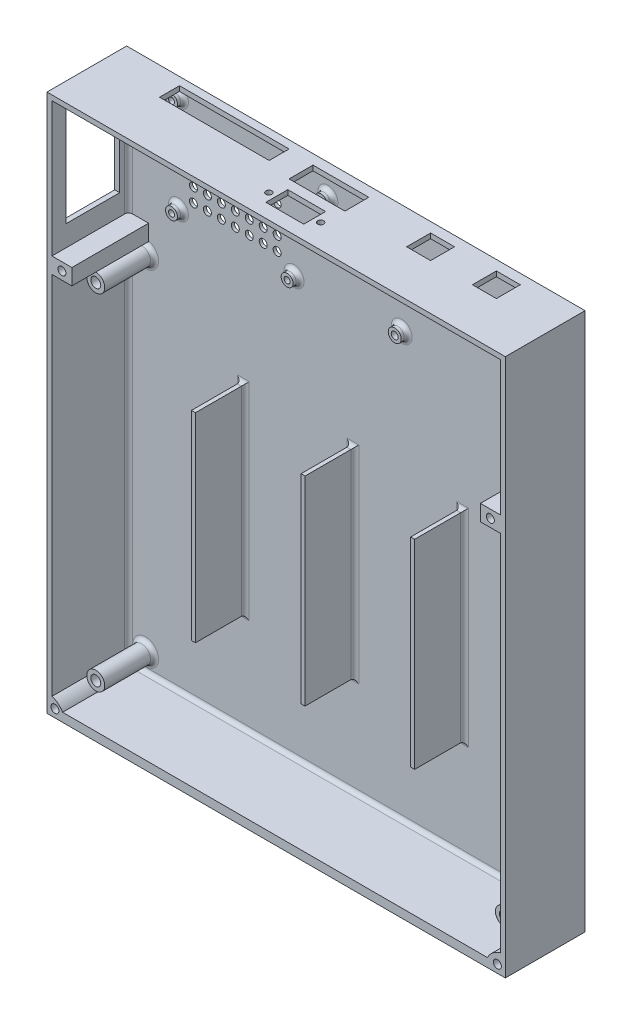
from build123d import *

# Parameters (mm, degrees)
ESQUISSE1_W              = 230
ESQUISSE1_H              = 270
BOSS_EXTRU_1_DEPTH       = 5
ESQUISSE2_R              = 2
ESQUISSE2_R_2            = 1.75
ESQUISSE2_R_3            = 1.5
ENL_V_MAT_EXTRU_1_DEPTH  = 5
COQUE3_T                 = -1.5
ESQUISSE3_R              = 4.5
ESQUISSE3_R_2            = 2.5
BOSS_EXTRU_3_DEPTH       = 25
ESQUISSE4_W              = 1
ESQUISSE4_H              = 267
BOSS_EXTRU_4_DEPTH       = 3.5
ESQUISSE5_W              = 225
ESQUISSE5_H              = 1
ESQUISSE5_H_2            = 2.9
BOSS_EXTRU_10_DEPTH      = 3.5
ESQUISSE7_W              = 2
ESQUISSE7_H              = 100
BOSS_EXTRU_11_DEPTH      = 25
ESQUISSE8_W              = 230
ESQUISSE8_H              = 270
ESQUISSE8_W_2            = 225
ESQUISSE8_H_2            = 263.1
BOSS_EXTRU_12_DEPTH      = 35
CONG_1_R                 = 2
ESQUISSE11_W             = 55
ESQUISSE11_H             = 10
ESQUISSE11_W_2           = 28
ESQUISSE11_H_2           = 12
ESQUISSE11_W_3           = 12
ENL_V_MAT_EXTRU_3_DEPTH  = 10
ESQUISSE13_W             = 27
ESQUISSE13_H             = 55
ENL_V_MAT_EXTRU_4_DEPTH  = 10
ESQUISSE14_R             = 2
ENL_V_MAT_EXTRU_5_DEPTH  = 10
BOSS_EXTRU_13_DEPTH      = 40
BOSS_EXTRU_14_START      = 13.5
BOSS_EXTRU_14_DEPTH      = 40
ENL_V_START              = 13.5
ESQUISSE17_R             = 2
ENL_V_MAT_EXTRU_6_DEPTH  = 40
ESQUISSE18_R             = 2
ENL_V_MAT_EXTRU_7_DEPTH  = 40
ESQUISSE21_R             = 1.5
ESQUISSE21_W             = 19
ESQUISSE21_H             = 11
ENL_V_MAT_EXTRU_8_DEPTH  = 2.5
ESQUISSE28_W             = 10
ESQUISSE28_H             = 8
BOSS_EXTRU_16_DEPTH      = 38.5
ESQUISSE29_R             = 2
ENL_V_MAT_EXTRU_10_DEPTH = 215.474512253
ESQUISSE30_W             = 10
ESQUISSE30_H             = 8
BOSS_EXTRU_17_DEPTH      = 38.5
ESQUISSE31_R             = 2
ENL_V_MAT_EXTRU_11_DEPTH = 215.474512253


with BuildPart() as part:
    # Esquisse1 → Boss.-Extru.1 (new body)
    with BuildSketch(Plane.XY):
        with Locations((0, -41.5625)):
            Rectangle(ESQUISSE1_W, ESQUISSE1_H)
    extrude(amount=BOSS_EXTRU_1_DEPTH)

    # Esquisse2 → Enlèv. mat.-Extru.1 (cut)
    with BuildSketch(Plane.XY.offset(5)):
        with Locations((-104, -163.5625)):
            Circle(ESQUISSE2_R)
        with Locations(Location((-104, 9.4375, 0), (0, 0, 180))):
            Circle(ESQUISSE2_R)
        with Locations((104.5, 82.9375)):
            Circle(ESQUISSE2_R_2)
        with Locations((24.5, 82.9375)):
            Circle(ESQUISSE2_R_2)
        with Locations(Location((24.5, 39.9375, 0), (0, 0, 180))):
            Circle(ESQUISSE2_R_2)
        with Locations(Location((104.5, 39.9375, 0), (0, 0, 180))):
            Circle(ESQUISSE2_R_2)
        with Locations((-87.5, 85.9375)):
            Circle(ESQUISSE2_R_3)
        with Locations(Location((-29.5, 85.9375, 0), (0, 0, 180))):
            Circle(ESQUISSE2_R_3)
        with Locations((8.5, 67.4375)):
            Circle(ESQUISSE2_R_3)
        with Locations(Location((-12.5, 67.4375, 0), (0, 0, 180))):
            Circle(ESQUISSE2_R_3)
        with Locations((-12.5, 79.9375)):
            Circle(ESQUISSE2_R_3)
        with Locations(Location((8.5, 79.9375, 0), (0, 0, 180))):
            Circle(ESQUISSE2_R_3)
        with Locations(Location((101, -163.5625, 0), (0, 0, 180))):
            Circle(ESQUISSE2_R)
        with Locations((101, 9.4375)):
            Circle(ESQUISSE2_R)
        with Locations(Location((-87.5, 36.9375, 0), (0, 0, 180))):
            Circle(ESQUISSE2_R_3)
        with Locations((-29.5, 36.9375)):
            Circle(ESQUISSE2_R_3)
    extrude(amount=-ENL_V_MAT_EXTRU_1_DEPTH, mode=Mode.SUBTRACT)

    # Coque3
    coque3_openings = [part.faces().sort_by_distance(p)[0] for p in [
        (-0.011238138, -41.697281592, 5),
    ]]
    offset(amount=COQUE3_T, openings=coque3_openings, kind=Kind.INTERSECTION)

    # Esquisse3 → Boss.-Extru.3 (add)
    # profile 1 of 4: a face of its own
    with BuildSketch(Plane.XY.offset(1.5)):
        with Locations(Location((-104, 9.4375, 0), (0, 0, 180))):
            Circle(ESQUISSE3_R)
        with Locations(Location((-104, 9.4375, 0), (0, 0, 180))):
            Circle(ESQUISSE3_R_2, mode=Mode.SUBTRACT)
    # profile 2 of 4: a face of its own
    with BuildSketch(Plane.XY.offset(1.5)):
        with Locations(Location((-104, -163.5625, 0), (0, 0, 180))):
            Circle(ESQUISSE3_R)
        with Locations(Location((-104, -163.5625, 0), (0, 0, 180))):
            Circle(ESQUISSE3_R_2, mode=Mode.SUBTRACT)
    # profile 3 of 4: a face of its own
    with BuildSketch(Plane.XY.offset(1.5)):
        with Locations(Location((101, -163.5625, 0), (0, 0, 180))):
            Circle(ESQUISSE3_R)
        with Locations(Location((101, -163.5625, 0), (0, 0, 180))):
            Circle(ESQUISSE3_R_2, mode=Mode.SUBTRACT)
    # profile 4 of 4: a face of its own
    with BuildSketch(Plane.XY.offset(1.5)):
        with Locations(Location((101, 9.4375, 0), (0, 0, 180))):
            Circle(ESQUISSE3_R)
        with Locations(Location((101, 9.4375, 0), (0, 0, 180))):
            Circle(ESQUISSE3_R_2, mode=Mode.SUBTRACT)
    extrude(amount=BOSS_EXTRU_3_DEPTH)

    # Esquisse4 → Boss.-Extru.4 (add)
    with BuildSketch(Plane.XY.offset(1.5)):
        with Locations((-113, -41.5625)):
            Rectangle(ESQUISSE4_W, ESQUISSE4_H)
        with Locations((113, -41.5625)):
            Rectangle(ESQUISSE4_W, ESQUISSE4_H)
    extrude(amount=BOSS_EXTRU_4_DEPTH)

    # Esquisse5 → Boss.-Extru.10 (add)
    with BuildSketch(Plane.XY.offset(1.5)):
        with Locations((0, 91.4375)):
            Rectangle(ESQUISSE5_W, ESQUISSE5_H)
        with Locations((0, -173.6125)):
            Rectangle(ESQUISSE5_W, ESQUISSE5_H_2)
    extrude(amount=BOSS_EXTRU_10_DEPTH)

    # Esquisse7 → Boss.-Extru.11 (add)
    with BuildSketch(Plane.XY.offset(1.5)):
        with Locations((0, -72.1625)):
            Rectangle(ESQUISSE7_W, ESQUISSE7_H)
        with Locations((-55, -72.1625)):
            Rectangle(ESQUISSE7_W, ESQUISSE7_H)
        with Locations((55, -72.1625)):
            Rectangle(ESQUISSE7_W, ESQUISSE7_H)
    extrude(amount=BOSS_EXTRU_11_DEPTH)

    # Esquisse8 → Boss.-Extru.12 (add)
    with BuildSketch(Plane.XY.offset(5)):
        with Locations((0, -41.5625)):
            Rectangle(ESQUISSE8_W, ESQUISSE8_H)
        with Locations((0, -40.6125)):
            Rectangle(ESQUISSE8_W_2, ESQUISSE8_H_2, mode=Mode.SUBTRACT)
    extrude(amount=BOSS_EXTRU_12_DEPTH)

    # Congé1
    # the kernel refuses this fillet: 2 mm, written as the material it adds along each edge
    with BuildSketch(Plane(origin=(-104, 9.4375, 1.5), x_dir=(-1, 0, 0), z_dir=(0, 1, 0))) as cong_1_piece_1:
        with BuildLine():
            CenterArc((4.5 + CONG_1_R, CONG_1_R), CONG_1_R, 180, 90)
            Line((4.5, CONG_1_R), (4.5 - CONG_1_R * 0.02, CONG_1_R))
            Line((4.5 - CONG_1_R * 0.02, CONG_1_R), (4.5 - CONG_1_R * 0.02, -CONG_1_R * 0.02))
            Line((4.5 - CONG_1_R * 0.02, -CONG_1_R * 0.02), (4.5 + CONG_1_R, -CONG_1_R * 0.02))
            Line((4.5 + CONG_1_R, -CONG_1_R * 0.02), (4.5 + CONG_1_R, 0))
        make_face()
    revolve(axis=Axis((-104, 9.4375, 1.5), (0, 0, 1)))
    with BuildSketch(Plane(origin=(101, -163.5625, 1.5), x_dir=(-1, 0, 0), z_dir=(0, 1, 0))) as cong_1_piece_2:
        with BuildLine():
            CenterArc((4.5 + CONG_1_R, CONG_1_R), CONG_1_R, 180, 90)
            Line((4.5, CONG_1_R), (4.5 - CONG_1_R * 0.02, CONG_1_R))
            Line((4.5 - CONG_1_R * 0.02, CONG_1_R), (4.5 - CONG_1_R * 0.02, -CONG_1_R * 0.02))
            Line((4.5 - CONG_1_R * 0.02, -CONG_1_R * 0.02), (4.5 + CONG_1_R, -CONG_1_R * 0.02))
            Line((4.5 + CONG_1_R, -CONG_1_R * 0.02), (4.5 + CONG_1_R, 0))
        make_face()
    revolve(axis=Axis((101, -163.5625, 1.5), (0, 0, 1)))
    with BuildSketch(Plane(origin=(-104, -163.5625, 1.5), x_dir=(-1, 0, 0), z_dir=(0, 1, 0))) as cong_1_piece_3:
        with BuildLine():
            CenterArc((4.5 + CONG_1_R, CONG_1_R), CONG_1_R, 180, 90)
            Line((4.5, CONG_1_R), (4.5 - CONG_1_R * 0.02, CONG_1_R))
            Line((4.5 - CONG_1_R * 0.02, CONG_1_R), (4.5 - CONG_1_R * 0.02, -CONG_1_R * 0.02))
            Line((4.5 - CONG_1_R * 0.02, -CONG_1_R * 0.02), (4.5 + CONG_1_R, -CONG_1_R * 0.02))
            Line((4.5 + CONG_1_R, -CONG_1_R * 0.02), (4.5 + CONG_1_R, 0))
        make_face()
    revolve(axis=Axis((-104, -163.5625, 1.5), (0, 0, 1)))
    with BuildSketch(Plane(origin=(101, 9.4375, 1.5), x_dir=(-1, 0, 0), z_dir=(0, 1, 0))) as cong_1_piece_4:
        with BuildLine():
            CenterArc((4.5 + CONG_1_R, CONG_1_R), CONG_1_R, 180, 90)
            Line((4.5, CONG_1_R), (4.5 - CONG_1_R * 0.02, CONG_1_R))
            Line((4.5 - CONG_1_R * 0.02, CONG_1_R), (4.5 - CONG_1_R * 0.02, -CONG_1_R * 0.02))
            Line((4.5 - CONG_1_R * 0.02, -CONG_1_R * 0.02), (4.5 + CONG_1_R, -CONG_1_R * 0.02))
            Line((4.5 + CONG_1_R, -CONG_1_R * 0.02), (4.5 + CONG_1_R, 0))
        make_face()
    revolve(axis=Axis((101, 9.4375, 1.5), (0, 0, 1)))
    with BuildSketch(Plane(origin=(112.5, -172.1625, 1.5), x_dir=(-1, 0, 0), z_dir=(0, 1, 0)), Plane(origin=(-112.5, 90.9375, 1.5), x_dir=(1, 0, 0), z_dir=(0, -1, 0))) as cong_1_piece_5:
        with BuildLine():
            CenterArc((CONG_1_R, CONG_1_R), CONG_1_R, 180, 90)
            Line((0, CONG_1_R), (-CONG_1_R * 0.02, CONG_1_R))
            Line((-CONG_1_R * 0.02, CONG_1_R), (-CONG_1_R * 0.02, -CONG_1_R * 0.02))
            Line((-CONG_1_R * 0.02, -CONG_1_R * 0.02), (CONG_1_R, -CONG_1_R * 0.02))
            Line((CONG_1_R, -CONG_1_R * 0.02), (CONG_1_R, 0))
        make_face()
    extrude(amount=263.1)
    with BuildSketch(Plane(origin=(112.5, 90.9375, 1.5), x_dir=(0, -1, 0), z_dir=(-1, 0, 0)), Plane(origin=(-112.5, -172.1625, 1.5), x_dir=(0, 1, 0), z_dir=(1, 0, 0))) as cong_1_piece_6:
        with BuildLine():
            CenterArc((CONG_1_R, CONG_1_R), CONG_1_R, 180, 90)
            Line((0, CONG_1_R), (-CONG_1_R * 0.02, CONG_1_R))
            Line((-CONG_1_R * 0.02, CONG_1_R), (-CONG_1_R * 0.02, -CONG_1_R * 0.02))
            Line((-CONG_1_R * 0.02, -CONG_1_R * 0.02), (CONG_1_R, -CONG_1_R * 0.02))
            Line((CONG_1_R, -CONG_1_R * 0.02), (CONG_1_R, 0))
        make_face()
    extrude(amount=225)
    with BuildSketch(Plane(origin=(-56, -122.1625, 1.5), x_dir=(-1, 0, 0), z_dir=(0, 1, 0)), Plane(origin=(-54, -22.1625, 1.5), x_dir=(1, 0, 0), z_dir=(0, -1, 0)), Plane(origin=(-1, -122.1625, 1.5), x_dir=(-1, 0, 0), z_dir=(0, 1, 0)), Plane(origin=(1, -22.1625, 1.5), x_dir=(1, 0, 0), z_dir=(0, -1, 0)), Plane(origin=(54, -122.1625, 1.5), x_dir=(-1, 0, 0), z_dir=(0, 1, 0)), Plane(origin=(56, -22.1625, 1.5), x_dir=(1, 0, 0), z_dir=(0, -1, 0))) as cong_1_piece_7:
        with BuildLine():
            CenterArc((CONG_1_R, CONG_1_R), CONG_1_R, 180, 90)
            Line((0, CONG_1_R), (-CONG_1_R * 0.02, CONG_1_R))
            Line((-CONG_1_R * 0.02, CONG_1_R), (-CONG_1_R * 0.02, -CONG_1_R * 0.02))
            Line((-CONG_1_R * 0.02, -CONG_1_R * 0.02), (CONG_1_R, -CONG_1_R * 0.02))
            Line((CONG_1_R, -CONG_1_R * 0.02), (CONG_1_R, 0))
        make_face()
    extrude(amount=100)
    with BuildSketch(Plane(origin=(-54, -122.1625, 1.5), x_dir=(0, -1, 0), z_dir=(-1, 0, 0)), Plane(origin=(-56, -22.1625, 1.5), x_dir=(0, 1, 0), z_dir=(1, 0, 0)), Plane(origin=(1, -122.1625, 1.5), x_dir=(0, -1, 0), z_dir=(-1, 0, 0)), Plane(origin=(-1, -22.1625, 1.5), x_dir=(0, 1, 0), z_dir=(1, 0, 0)), Plane(origin=(56, -122.1625, 1.5), x_dir=(0, -1, 0), z_dir=(-1, 0, 0)), Plane(origin=(54, -22.1625, 1.5), x_dir=(0, 1, 0), z_dir=(1, 0, 0))) as cong_1_piece_8:
        with BuildLine():
            CenterArc((CONG_1_R, CONG_1_R), CONG_1_R, 180, 90)
            Line((0, CONG_1_R), (-CONG_1_R * 0.02, CONG_1_R))
            Line((-CONG_1_R * 0.02, CONG_1_R), (-CONG_1_R * 0.02, -CONG_1_R * 0.02))
            Line((-CONG_1_R * 0.02, -CONG_1_R * 0.02), (CONG_1_R, -CONG_1_R * 0.02))
            Line((CONG_1_R, -CONG_1_R * 0.02), (CONG_1_R, 0))
        make_face()
    extrude(amount=2)
    with BuildSketch(Plane(origin=(104.5, 39.9375, 1.5), x_dir=(-1, 0, 0), z_dir=(0, 1, 0))) as cong_1_piece_9:
        with BuildLine():
            CenterArc((3.25 + CONG_1_R, CONG_1_R), CONG_1_R, 180, 90)
            Line((3.25, CONG_1_R), (3.25 - CONG_1_R * 0.02, CONG_1_R))
            Line((3.25 - CONG_1_R * 0.02, CONG_1_R), (3.25 - CONG_1_R * 0.02, -CONG_1_R * 0.02))
            Line((3.25 - CONG_1_R * 0.02, -CONG_1_R * 0.02), (3.25 + CONG_1_R, -CONG_1_R * 0.02))
            Line((3.25 + CONG_1_R, -CONG_1_R * 0.02), (3.25 + CONG_1_R, 0))
        make_face()
    revolve(axis=Axis((104.5, 39.9375, 1.5), (0, 0, 1)))
    with BuildSketch(Plane(origin=(24.5, 39.9375, 1.5), x_dir=(-1, 0, 0), z_dir=(0, 1, 0))) as cong_1_piece_10:
        with BuildLine():
            CenterArc((3.25 + CONG_1_R, CONG_1_R), CONG_1_R, 180, 90)
            Line((3.25, CONG_1_R), (3.25 - CONG_1_R * 0.02, CONG_1_R))
            Line((3.25 - CONG_1_R * 0.02, CONG_1_R), (3.25 - CONG_1_R * 0.02, -CONG_1_R * 0.02))
            Line((3.25 - CONG_1_R * 0.02, -CONG_1_R * 0.02), (3.25 + CONG_1_R, -CONG_1_R * 0.02))
            Line((3.25 + CONG_1_R, -CONG_1_R * 0.02), (3.25 + CONG_1_R, 0))
        make_face()
    revolve(axis=Axis((24.5, 39.9375, 1.5), (0, 0, 1)))
    with BuildSketch(Plane(origin=(24.5, 82.9375, 1.5), x_dir=(1, 0, 0), z_dir=(0, -1, 0))) as cong_1_piece_11:
        with BuildLine():
            CenterArc((3.25 + CONG_1_R, CONG_1_R), CONG_1_R, 180, 90)
            Line((3.25, CONG_1_R), (3.25 - CONG_1_R * 0.02, CONG_1_R))
            Line((3.25 - CONG_1_R * 0.02, CONG_1_R), (3.25 - CONG_1_R * 0.02, -CONG_1_R * 0.02))
            Line((3.25 - CONG_1_R * 0.02, -CONG_1_R * 0.02), (3.25 + CONG_1_R, -CONG_1_R * 0.02))
            Line((3.25 + CONG_1_R, -CONG_1_R * 0.02), (3.25 + CONG_1_R, 0))
        make_face()
    revolve(axis=Axis((24.5, 82.9375, 1.5), (0, 0, 1)))
    with BuildSketch(Plane(origin=(104.5, 82.9375, 1.5), x_dir=(1, 0, 0), z_dir=(0, -1, 0))) as cong_1_piece_12:
        with BuildLine():
            CenterArc((3.25 + CONG_1_R, CONG_1_R), CONG_1_R, 180, 90)
            Line((3.25 + CONG_1_R, 0), (3.25 + CONG_1_R, -CONG_1_R * 0.02))
            Line((3.25 + CONG_1_R, -CONG_1_R * 0.02), (3.25 - CONG_1_R * 0.02, -CONG_1_R * 0.02))
            Line((3.25 - CONG_1_R * 0.02, -CONG_1_R * 0.02), (3.25 - CONG_1_R * 0.02, CONG_1_R))
            Line((3.25 - CONG_1_R * 0.02, CONG_1_R), (3.25, CONG_1_R))
        make_face()
    revolve(axis=Axis((104.5, 82.9375, 1.5), (0, 0, 1)))
    with BuildSketch(Plane(origin=(8.5, 67.4375, 1.5), x_dir=(1, 0, 0), z_dir=(0, -1, 0))) as cong_1_piece_13:
        with BuildLine():
            CenterArc((3 + CONG_1_R, CONG_1_R), CONG_1_R, 180, 90)
            Line((3, CONG_1_R), (3 - CONG_1_R * 0.02, CONG_1_R))
            Line((3 - CONG_1_R * 0.02, CONG_1_R), (3 - CONG_1_R * 0.02, -CONG_1_R * 0.02))
            Line((3 - CONG_1_R * 0.02, -CONG_1_R * 0.02), (3 + CONG_1_R, -CONG_1_R * 0.02))
            Line((3 + CONG_1_R, -CONG_1_R * 0.02), (3 + CONG_1_R, 0))
        make_face()
    revolve(axis=Axis((8.5, 67.4375, 1.5), (0, 0, 1)))
    with BuildSketch(Plane(origin=(-87.5, 85.9375, 1.5), x_dir=(1, 0, 0), z_dir=(0, -1, 0))) as cong_1_piece_14:
        with BuildLine():
            CenterArc((3 + CONG_1_R, CONG_1_R), CONG_1_R, 180, 90)
            Line((3, CONG_1_R), (3 - CONG_1_R * 0.02, CONG_1_R))
            Line((3 - CONG_1_R * 0.02, CONG_1_R), (3 - CONG_1_R * 0.02, -CONG_1_R * 0.02))
            Line((3 - CONG_1_R * 0.02, -CONG_1_R * 0.02), (3 + CONG_1_R, -CONG_1_R * 0.02))
            Line((3 + CONG_1_R, -CONG_1_R * 0.02), (3 + CONG_1_R, 0))
        make_face()
    revolve(axis=Axis((-87.5, 85.9375, 1.5), (0, 0, 1)))
    with BuildSketch(Plane(origin=(-29.5, 85.9375, 1.5), x_dir=(-1, 0, 0), z_dir=(0, 1, 0))) as cong_1_piece_15:
        with BuildLine():
            CenterArc((3 + CONG_1_R, CONG_1_R), CONG_1_R, 180, 90)
            Line((3, CONG_1_R), (3 - CONG_1_R * 0.02, CONG_1_R))
            Line((3 - CONG_1_R * 0.02, CONG_1_R), (3 - CONG_1_R * 0.02, -CONG_1_R * 0.02))
            Line((3 - CONG_1_R * 0.02, -CONG_1_R * 0.02), (3 + CONG_1_R, -CONG_1_R * 0.02))
            Line((3 + CONG_1_R, -CONG_1_R * 0.02), (3 + CONG_1_R, 0))
        make_face()
    revolve(axis=Axis((-29.5, 85.9375, 1.5), (0, 0, 1)))
    with BuildSketch(Plane(origin=(-87.5, 36.9375, 1.5), x_dir=(-1, 0, 0), z_dir=(0, 1, 0))) as cong_1_piece_16:
        with BuildLine():
            CenterArc((3 + CONG_1_R, CONG_1_R), CONG_1_R, 180, 90)
            Line((3, CONG_1_R), (3 - CONG_1_R * 0.02, CONG_1_R))
            Line((3 - CONG_1_R * 0.02, CONG_1_R), (3 - CONG_1_R * 0.02, -CONG_1_R * 0.02))
            Line((3 - CONG_1_R * 0.02, -CONG_1_R * 0.02), (3 + CONG_1_R, -CONG_1_R * 0.02))
            Line((3 + CONG_1_R, -CONG_1_R * 0.02), (3 + CONG_1_R, 0))
        make_face()
    revolve(axis=Axis((-87.5, 36.9375, 1.5), (0, 0, 1)))
    with BuildSketch(Plane(origin=(-29.5, 36.9375, 1.5), x_dir=(1, 0, 0), z_dir=(0, -1, 0))) as cong_1_piece_17:
        with BuildLine():
            CenterArc((3 + CONG_1_R, CONG_1_R), CONG_1_R, 180, 90)
            Line((3, CONG_1_R), (3 - CONG_1_R * 0.02, CONG_1_R))
            Line((3 - CONG_1_R * 0.02, CONG_1_R), (3 - CONG_1_R * 0.02, -CONG_1_R * 0.02))
            Line((3 - CONG_1_R * 0.02, -CONG_1_R * 0.02), (3 + CONG_1_R, -CONG_1_R * 0.02))
            Line((3 + CONG_1_R, -CONG_1_R * 0.02), (3 + CONG_1_R, 0))
        make_face()
    revolve(axis=Axis((-29.5, 36.9375, 1.5), (0, 0, 1)))
    with BuildSketch(Plane(origin=(-12.5, 67.4375, 1.5), x_dir=(-1, 0, 0), z_dir=(0, 1, 0))) as cong_1_piece_18:
        with BuildLine():
            CenterArc((3 + CONG_1_R, CONG_1_R), CONG_1_R, 180, 90)
            Line((3, CONG_1_R), (3 - CONG_1_R * 0.02, CONG_1_R))
            Line((3 - CONG_1_R * 0.02, CONG_1_R), (3 - CONG_1_R * 0.02, -CONG_1_R * 0.02))
            Line((3 - CONG_1_R * 0.02, -CONG_1_R * 0.02), (3 + CONG_1_R, -CONG_1_R * 0.02))
            Line((3 + CONG_1_R, -CONG_1_R * 0.02), (3 + CONG_1_R, 0))
        make_face()
    revolve(axis=Axis((-12.5, 67.4375, 1.5), (0, 0, 1)))
    with BuildSketch(Plane(origin=(-12.5, 79.9375, 1.5), x_dir=(1, 0, 0), z_dir=(0, -1, 0))) as cong_1_piece_19:
        with BuildLine():
            CenterArc((3 + CONG_1_R, CONG_1_R), CONG_1_R, 180, 90)
            Line((3, CONG_1_R), (3 - CONG_1_R * 0.02, CONG_1_R))
            Line((3 - CONG_1_R * 0.02, CONG_1_R), (3 - CONG_1_R * 0.02, -CONG_1_R * 0.02))
            Line((3 - CONG_1_R * 0.02, -CONG_1_R * 0.02), (3 + CONG_1_R, -CONG_1_R * 0.02))
            Line((3 + CONG_1_R, -CONG_1_R * 0.02), (3 + CONG_1_R, 0))
        make_face()
    revolve(axis=Axis((-12.5, 79.9375, 1.5), (0, 0, 1)))
    with BuildSketch(Plane(origin=(8.5, 79.9375, 1.5), x_dir=(-1, 0, 0), z_dir=(0, 1, 0))) as cong_1_piece_20:
        with BuildLine():
            CenterArc((3 + CONG_1_R, CONG_1_R), CONG_1_R, 180, 90)
            Line((3, CONG_1_R), (3 - CONG_1_R * 0.02, CONG_1_R))
            Line((3 - CONG_1_R * 0.02, CONG_1_R), (3 - CONG_1_R * 0.02, -CONG_1_R * 0.02))
            Line((3 - CONG_1_R * 0.02, -CONG_1_R * 0.02), (3 + CONG_1_R, -CONG_1_R * 0.02))
            Line((3 + CONG_1_R, -CONG_1_R * 0.02), (3 + CONG_1_R, 0))
        make_face()
    revolve(axis=Axis((8.5, 79.9375, 1.5), (0, 0, 1)))
    with BuildSketch(Plane(origin=(-112.5, -172.1625, 1.5), x_dir=(0, 1, 0), z_dir=(1, 0, 0))) as cong_1_piece_21a_section:
        with BuildLine():
            CenterArc((CONG_1_R, CONG_1_R), CONG_1_R, 180, 90)
            Line((0, CONG_1_R), (-CONG_1_R * 0.02, CONG_1_R))
            Line((-CONG_1_R * 0.02, CONG_1_R), (-CONG_1_R * 0.02, -CONG_1_R * 0.02))
            Line((-CONG_1_R * 0.02, -CONG_1_R * 0.02), (CONG_1_R, -CONG_1_R * 0.02))
            Line((CONG_1_R, -CONG_1_R * 0.02), (CONG_1_R, 0))
        make_face()
    cong_1_piece_21a = extrude(amount=230, mode=Mode.PRIVATE)
    cong_1_piece_21a = split(cong_1_piece_21a, bisect_by=Plane(origin=(112.5, -171.709709771, 1.952790229), z_dir=(1, 0, 0)), keep=Keep.TOP, mode=Mode.PRIVATE)
    with BuildSketch(Plane(origin=(112.5, -177.1625, 1.5), x_dir=(-1, 0, 0), z_dir=(0, 1, 0))) as cong_1_piece_21b_section:
        with BuildLine():
            CenterArc((CONG_1_R, CONG_1_R), CONG_1_R, 180, 90)
            Line((0, CONG_1_R), (-CONG_1_R * 0.02, CONG_1_R))
            Line((-CONG_1_R * 0.02, CONG_1_R), (-CONG_1_R * 0.02, -CONG_1_R * 0.02))
            Line((-CONG_1_R * 0.02, -CONG_1_R * 0.02), (CONG_1_R, -CONG_1_R * 0.02))
            Line((CONG_1_R, -CONG_1_R * 0.02), (CONG_1_R, 0))
        make_face()
    cong_1_piece_21b = extrude(amount=268.1, mode=Mode.PRIVATE)
    cong_1_piece_21b = split(cong_1_piece_21b, bisect_by=Plane(origin=(112.047209771, -172.1625, 1.952790229), z_dir=(0, -1, 0)), keep=Keep.TOP, mode=Mode.PRIVATE)
    cong_1_piece_21 = cong_1_piece_21a & cong_1_piece_21b
    add(cong_1_piece_21)
    with BuildSketch(Plane(origin=(112.5, -172.1625, 1.5), x_dir=(-1, 0, 0), z_dir=(0, 1, 0))) as cong_1_piece_22a_section:
        with BuildLine():
            CenterArc((CONG_1_R, CONG_1_R), CONG_1_R, 180, 90)
            Line((0, CONG_1_R), (-CONG_1_R * 0.02, CONG_1_R))
            Line((-CONG_1_R * 0.02, CONG_1_R), (-CONG_1_R * 0.02, -CONG_1_R * 0.02))
            Line((-CONG_1_R * 0.02, -CONG_1_R * 0.02), (CONG_1_R, -CONG_1_R * 0.02))
            Line((CONG_1_R, -CONG_1_R * 0.02), (CONG_1_R, 0))
        make_face()
    cong_1_piece_22a = extrude(amount=268.1, mode=Mode.PRIVATE)
    cong_1_piece_22a = split(cong_1_piece_22a, bisect_by=Plane(origin=(112.047209771, 90.9375, 1.952790229), z_dir=(0, 1, 0)), keep=Keep.TOP, mode=Mode.PRIVATE)
    with BuildSketch(Plane(origin=(117.5, 90.9375, 1.5), x_dir=(0, -1, 0), z_dir=(-1, 0, 0))) as cong_1_piece_22b_section:
        with BuildLine():
            CenterArc((CONG_1_R, CONG_1_R), CONG_1_R, 180, 90)
            Line((0, CONG_1_R), (-CONG_1_R * 0.02, CONG_1_R))
            Line((-CONG_1_R * 0.02, CONG_1_R), (-CONG_1_R * 0.02, -CONG_1_R * 0.02))
            Line((-CONG_1_R * 0.02, -CONG_1_R * 0.02), (CONG_1_R, -CONG_1_R * 0.02))
            Line((CONG_1_R, -CONG_1_R * 0.02), (CONG_1_R, 0))
        make_face()
    cong_1_piece_22b = extrude(amount=230, mode=Mode.PRIVATE)
    cong_1_piece_22b = split(cong_1_piece_22b, bisect_by=Plane(origin=(112.5, 90.484709771, 1.952790229), z_dir=(1, 0, 0)), keep=Keep.TOP, mode=Mode.PRIVATE)
    cong_1_piece_22 = cong_1_piece_22a & cong_1_piece_22b
    add(cong_1_piece_22)
    with BuildSketch(Plane(origin=(-112.5, 95.9375, 1.5), x_dir=(1, 0, 0), z_dir=(0, -1, 0))) as cong_1_piece_23a_section:
        with BuildLine():
            CenterArc((CONG_1_R, CONG_1_R), CONG_1_R, 180, 90)
            Line((0, CONG_1_R), (-CONG_1_R * 0.02, CONG_1_R))
            Line((-CONG_1_R * 0.02, CONG_1_R), (-CONG_1_R * 0.02, -CONG_1_R * 0.02))
            Line((-CONG_1_R * 0.02, -CONG_1_R * 0.02), (CONG_1_R, -CONG_1_R * 0.02))
            Line((CONG_1_R, -CONG_1_R * 0.02), (CONG_1_R, 0))
        make_face()
    cong_1_piece_23a = extrude(amount=268.1, mode=Mode.PRIVATE)
    cong_1_piece_23a = split(cong_1_piece_23a, bisect_by=Plane(origin=(-112.047209771, 90.9375, 1.952790229), z_dir=(0, 1, 0)), keep=Keep.TOP, mode=Mode.PRIVATE)
    with BuildSketch(Plane(origin=(112.5, 90.9375, 1.5), x_dir=(0, -1, 0), z_dir=(-1, 0, 0))) as cong_1_piece_23b_section:
        with BuildLine():
            CenterArc((CONG_1_R, CONG_1_R), CONG_1_R, 180, 90)
            Line((0, CONG_1_R), (-CONG_1_R * 0.02, CONG_1_R))
            Line((-CONG_1_R * 0.02, CONG_1_R), (-CONG_1_R * 0.02, -CONG_1_R * 0.02))
            Line((-CONG_1_R * 0.02, -CONG_1_R * 0.02), (CONG_1_R, -CONG_1_R * 0.02))
            Line((CONG_1_R, -CONG_1_R * 0.02), (CONG_1_R, 0))
        make_face()
    cong_1_piece_23b = extrude(amount=230, mode=Mode.PRIVATE)
    cong_1_piece_23b = split(cong_1_piece_23b, bisect_by=Plane(origin=(-112.5, 90.484709771, 1.952790229), z_dir=(-1, 0, 0)), keep=Keep.TOP, mode=Mode.PRIVATE)
    cong_1_piece_23 = cong_1_piece_23a & cong_1_piece_23b
    add(cong_1_piece_23)
    with BuildSketch(Plane(origin=(-117.5, -172.1625, 1.5), x_dir=(0, 1, 0), z_dir=(1, 0, 0))) as cong_1_piece_24a_section:
        with BuildLine():
            CenterArc((CONG_1_R, CONG_1_R), CONG_1_R, 180, 90)
            Line((0, CONG_1_R), (-CONG_1_R * 0.02, CONG_1_R))
            Line((-CONG_1_R * 0.02, CONG_1_R), (-CONG_1_R * 0.02, -CONG_1_R * 0.02))
            Line((-CONG_1_R * 0.02, -CONG_1_R * 0.02), (CONG_1_R, -CONG_1_R * 0.02))
            Line((CONG_1_R, -CONG_1_R * 0.02), (CONG_1_R, 0))
        make_face()
    cong_1_piece_24a = extrude(amount=230, mode=Mode.PRIVATE)
    cong_1_piece_24a = split(cong_1_piece_24a, bisect_by=Plane(origin=(-112.5, -171.709709771, 1.952790229), z_dir=(-1, 0, 0)), keep=Keep.TOP, mode=Mode.PRIVATE)
    with BuildSketch(Plane(origin=(-112.5, 90.9375, 1.5), x_dir=(1, 0, 0), z_dir=(0, -1, 0))) as cong_1_piece_24b_section:
        with BuildLine():
            CenterArc((CONG_1_R, CONG_1_R), CONG_1_R, 180, 90)
            Line((0, CONG_1_R), (-CONG_1_R * 0.02, CONG_1_R))
            Line((-CONG_1_R * 0.02, CONG_1_R), (-CONG_1_R * 0.02, -CONG_1_R * 0.02))
            Line((-CONG_1_R * 0.02, -CONG_1_R * 0.02), (CONG_1_R, -CONG_1_R * 0.02))
            Line((CONG_1_R, -CONG_1_R * 0.02), (CONG_1_R, 0))
        make_face()
    cong_1_piece_24b = extrude(amount=268.1, mode=Mode.PRIVATE)
    cong_1_piece_24b = split(cong_1_piece_24b, bisect_by=Plane(origin=(-112.047209771, -172.1625, 1.952790229), z_dir=(0, -1, 0)), keep=Keep.TOP, mode=Mode.PRIVATE)
    cong_1_piece_24 = cong_1_piece_24a & cong_1_piece_24b
    add(cong_1_piece_24)
    with BuildSketch(Plane(origin=(-56, -127.1625, 1.5), x_dir=(-1, 0, 0), z_dir=(0, 1, 0))) as cong_1_piece_25a_section:
        with BuildLine():
            CenterArc((CONG_1_R, CONG_1_R), CONG_1_R, 180, 90)
            Line((0, CONG_1_R), (-CONG_1_R * 0.02, CONG_1_R))
            Line((-CONG_1_R * 0.02, CONG_1_R), (-CONG_1_R * 0.02, -CONG_1_R * 0.02))
            Line((-CONG_1_R * 0.02, -CONG_1_R * 0.02), (CONG_1_R, -CONG_1_R * 0.02))
            Line((CONG_1_R, -CONG_1_R * 0.02), (CONG_1_R, 0))
        make_face()
    cong_1_piece_25a = extrude(amount=105, mode=Mode.PRIVATE)
    cong_1_piece_25a = split(cong_1_piece_25a, bisect_by=Plane(origin=(-56.452790229, -122.1625, 1.952790229), z_dir=(0, -1, 0)), keep=Keep.TOP, mode=Mode.PRIVATE)
    with BuildSketch(Plane(origin=(-54, -122.1625, 1.5), x_dir=(0, -1, 0), z_dir=(-1, 0, 0))) as cong_1_piece_25b_section:
        with BuildLine():
            CenterArc((CONG_1_R, CONG_1_R), CONG_1_R, 180, 90)
            Line((0, CONG_1_R), (-CONG_1_R * 0.02, CONG_1_R))
            Line((-CONG_1_R * 0.02, CONG_1_R), (-CONG_1_R * 0.02, -CONG_1_R * 0.02))
            Line((-CONG_1_R * 0.02, -CONG_1_R * 0.02), (CONG_1_R, -CONG_1_R * 0.02))
            Line((CONG_1_R, -CONG_1_R * 0.02), (CONG_1_R, 0))
        make_face()
    cong_1_piece_25b = extrude(amount=7, mode=Mode.PRIVATE)
    cong_1_piece_25b = split(cong_1_piece_25b, bisect_by=Plane(origin=(-56, -122.615290229, 1.952790229), z_dir=(-1, 0, 0)), keep=Keep.TOP, mode=Mode.PRIVATE)
    cong_1_piece_25 = cong_1_piece_25a & cong_1_piece_25b
    add(cong_1_piece_25)
    with BuildSketch(Plane(origin=(-56, -122.1625, 1.5), x_dir=(-1, 0, 0), z_dir=(0, 1, 0))) as cong_1_piece_26a_section:
        with BuildLine():
            CenterArc((CONG_1_R, CONG_1_R), CONG_1_R, 180, 90)
            Line((0, CONG_1_R), (-CONG_1_R * 0.02, CONG_1_R))
            Line((-CONG_1_R * 0.02, CONG_1_R), (-CONG_1_R * 0.02, -CONG_1_R * 0.02))
            Line((-CONG_1_R * 0.02, -CONG_1_R * 0.02), (CONG_1_R, -CONG_1_R * 0.02))
            Line((CONG_1_R, -CONG_1_R * 0.02), (CONG_1_R, 0))
        make_face()
    cong_1_piece_26a = extrude(amount=105, mode=Mode.PRIVATE)
    cong_1_piece_26a = split(cong_1_piece_26a, bisect_by=Plane(origin=(-56.452790229, -22.1625, 1.952790229), z_dir=(0, 1, 0)), keep=Keep.TOP, mode=Mode.PRIVATE)
    with BuildSketch(Plane(origin=(-61, -22.1625, 1.5), x_dir=(0, 1, 0), z_dir=(1, 0, 0))) as cong_1_piece_26b_section:
        with BuildLine():
            CenterArc((CONG_1_R, CONG_1_R), CONG_1_R, 180, 90)
            Line((0, CONG_1_R), (-CONG_1_R * 0.02, CONG_1_R))
            Line((-CONG_1_R * 0.02, CONG_1_R), (-CONG_1_R * 0.02, -CONG_1_R * 0.02))
            Line((-CONG_1_R * 0.02, -CONG_1_R * 0.02), (CONG_1_R, -CONG_1_R * 0.02))
            Line((CONG_1_R, -CONG_1_R * 0.02), (CONG_1_R, 0))
        make_face()
    cong_1_piece_26b = extrude(amount=7, mode=Mode.PRIVATE)
    cong_1_piece_26b = split(cong_1_piece_26b, bisect_by=Plane(origin=(-56, -21.709709771, 1.952790229), z_dir=(-1, 0, 0)), keep=Keep.TOP, mode=Mode.PRIVATE)
    cong_1_piece_26 = cong_1_piece_26a & cong_1_piece_26b
    add(cong_1_piece_26)
    with BuildSketch(Plane(origin=(-49, -122.1625, 1.5), x_dir=(0, -1, 0), z_dir=(-1, 0, 0))) as cong_1_piece_27a_section:
        with BuildLine():
            CenterArc((CONG_1_R, CONG_1_R), CONG_1_R, 180, 90)
            Line((0, CONG_1_R), (-CONG_1_R * 0.02, CONG_1_R))
            Line((-CONG_1_R * 0.02, CONG_1_R), (-CONG_1_R * 0.02, -CONG_1_R * 0.02))
            Line((-CONG_1_R * 0.02, -CONG_1_R * 0.02), (CONG_1_R, -CONG_1_R * 0.02))
            Line((CONG_1_R, -CONG_1_R * 0.02), (CONG_1_R, 0))
        make_face()
    cong_1_piece_27a = extrude(amount=7, mode=Mode.PRIVATE)
    cong_1_piece_27a = split(cong_1_piece_27a, bisect_by=Plane(origin=(-54, -122.615290229, 1.952790229), z_dir=(1, 0, 0)), keep=Keep.TOP, mode=Mode.PRIVATE)
    with BuildSketch(Plane(origin=(-54, -22.1625, 1.5), x_dir=(1, 0, 0), z_dir=(0, -1, 0))) as cong_1_piece_27b_section:
        with BuildLine():
            CenterArc((CONG_1_R, CONG_1_R), CONG_1_R, 180, 90)
            Line((0, CONG_1_R), (-CONG_1_R * 0.02, CONG_1_R))
            Line((-CONG_1_R * 0.02, CONG_1_R), (-CONG_1_R * 0.02, -CONG_1_R * 0.02))
            Line((-CONG_1_R * 0.02, -CONG_1_R * 0.02), (CONG_1_R, -CONG_1_R * 0.02))
            Line((CONG_1_R, -CONG_1_R * 0.02), (CONG_1_R, 0))
        make_face()
    cong_1_piece_27b = extrude(amount=105, mode=Mode.PRIVATE)
    cong_1_piece_27b = split(cong_1_piece_27b, bisect_by=Plane(origin=(-53.547209771, -122.1625, 1.952790229), z_dir=(0, -1, 0)), keep=Keep.TOP, mode=Mode.PRIVATE)
    cong_1_piece_27 = cong_1_piece_27a & cong_1_piece_27b
    add(cong_1_piece_27)
    with BuildSketch(Plane(origin=(-54, -17.1625, 1.5), x_dir=(1, 0, 0), z_dir=(0, -1, 0))) as cong_1_piece_28a_section:
        with BuildLine():
            CenterArc((CONG_1_R, CONG_1_R), CONG_1_R, 180, 90)
            Line((0, CONG_1_R), (-CONG_1_R * 0.02, CONG_1_R))
            Line((-CONG_1_R * 0.02, CONG_1_R), (-CONG_1_R * 0.02, -CONG_1_R * 0.02))
            Line((-CONG_1_R * 0.02, -CONG_1_R * 0.02), (CONG_1_R, -CONG_1_R * 0.02))
            Line((CONG_1_R, -CONG_1_R * 0.02), (CONG_1_R, 0))
        make_face()
    cong_1_piece_28a = extrude(amount=105, mode=Mode.PRIVATE)
    cong_1_piece_28a = split(cong_1_piece_28a, bisect_by=Plane(origin=(-53.547209771, -22.1625, 1.952790229), z_dir=(0, 1, 0)), keep=Keep.TOP, mode=Mode.PRIVATE)
    with BuildSketch(Plane(origin=(-56, -22.1625, 1.5), x_dir=(0, 1, 0), z_dir=(1, 0, 0))) as cong_1_piece_28b_section:
        with BuildLine():
            CenterArc((CONG_1_R, CONG_1_R), CONG_1_R, 180, 90)
            Line((0, CONG_1_R), (-CONG_1_R * 0.02, CONG_1_R))
            Line((-CONG_1_R * 0.02, CONG_1_R), (-CONG_1_R * 0.02, -CONG_1_R * 0.02))
            Line((-CONG_1_R * 0.02, -CONG_1_R * 0.02), (CONG_1_R, -CONG_1_R * 0.02))
            Line((CONG_1_R, -CONG_1_R * 0.02), (CONG_1_R, 0))
        make_face()
    cong_1_piece_28b = extrude(amount=7, mode=Mode.PRIVATE)
    cong_1_piece_28b = split(cong_1_piece_28b, bisect_by=Plane(origin=(-54, -21.709709771, 1.952790229), z_dir=(1, 0, 0)), keep=Keep.TOP, mode=Mode.PRIVATE)
    cong_1_piece_28 = cong_1_piece_28a & cong_1_piece_28b
    add(cong_1_piece_28)
    with BuildSketch(Plane(origin=(-1, -127.1625, 1.5), x_dir=(-1, 0, 0), z_dir=(0, 1, 0))) as cong_1_piece_29a_section:
        with BuildLine():
            CenterArc((CONG_1_R, CONG_1_R), CONG_1_R, 180, 90)
            Line((0, CONG_1_R), (-CONG_1_R * 0.02, CONG_1_R))
            Line((-CONG_1_R * 0.02, CONG_1_R), (-CONG_1_R * 0.02, -CONG_1_R * 0.02))
            Line((-CONG_1_R * 0.02, -CONG_1_R * 0.02), (CONG_1_R, -CONG_1_R * 0.02))
            Line((CONG_1_R, -CONG_1_R * 0.02), (CONG_1_R, 0))
        make_face()
    cong_1_piece_29a = extrude(amount=105, mode=Mode.PRIVATE)
    cong_1_piece_29a = split(cong_1_piece_29a, bisect_by=Plane(origin=(-1.452790229, -122.1625, 1.952790229), z_dir=(0, -1, 0)), keep=Keep.TOP, mode=Mode.PRIVATE)
    with BuildSketch(Plane(origin=(1, -122.1625, 1.5), x_dir=(0, -1, 0), z_dir=(-1, 0, 0))) as cong_1_piece_29b_section:
        with BuildLine():
            CenterArc((CONG_1_R, CONG_1_R), CONG_1_R, 180, 90)
            Line((0, CONG_1_R), (-CONG_1_R * 0.02, CONG_1_R))
            Line((-CONG_1_R * 0.02, CONG_1_R), (-CONG_1_R * 0.02, -CONG_1_R * 0.02))
            Line((-CONG_1_R * 0.02, -CONG_1_R * 0.02), (CONG_1_R, -CONG_1_R * 0.02))
            Line((CONG_1_R, -CONG_1_R * 0.02), (CONG_1_R, 0))
        make_face()
    cong_1_piece_29b = extrude(amount=7, mode=Mode.PRIVATE)
    cong_1_piece_29b = split(cong_1_piece_29b, bisect_by=Plane(origin=(-1, -122.615290229, 1.952790229), z_dir=(-1, 0, 0)), keep=Keep.TOP, mode=Mode.PRIVATE)
    cong_1_piece_29 = cong_1_piece_29a & cong_1_piece_29b
    add(cong_1_piece_29)
    with BuildSketch(Plane(origin=(-6, -22.1625, 1.5), x_dir=(0, 1, 0), z_dir=(1, 0, 0))) as cong_1_piece_30a_section:
        with BuildLine():
            CenterArc((CONG_1_R, CONG_1_R), CONG_1_R, 180, 90)
            Line((0, CONG_1_R), (-CONG_1_R * 0.02, CONG_1_R))
            Line((-CONG_1_R * 0.02, CONG_1_R), (-CONG_1_R * 0.02, -CONG_1_R * 0.02))
            Line((-CONG_1_R * 0.02, -CONG_1_R * 0.02), (CONG_1_R, -CONG_1_R * 0.02))
            Line((CONG_1_R, -CONG_1_R * 0.02), (CONG_1_R, 0))
        make_face()
    cong_1_piece_30a = extrude(amount=7, mode=Mode.PRIVATE)
    cong_1_piece_30a = split(cong_1_piece_30a, bisect_by=Plane(origin=(-1, -21.709709771, 1.952790229), z_dir=(-1, 0, 0)), keep=Keep.TOP, mode=Mode.PRIVATE)
    with BuildSketch(Plane(origin=(-1, -122.1625, 1.5), x_dir=(-1, 0, 0), z_dir=(0, 1, 0))) as cong_1_piece_30b_section:
        with BuildLine():
            CenterArc((CONG_1_R, CONG_1_R), CONG_1_R, 180, 90)
            Line((0, CONG_1_R), (-CONG_1_R * 0.02, CONG_1_R))
            Line((-CONG_1_R * 0.02, CONG_1_R), (-CONG_1_R * 0.02, -CONG_1_R * 0.02))
            Line((-CONG_1_R * 0.02, -CONG_1_R * 0.02), (CONG_1_R, -CONG_1_R * 0.02))
            Line((CONG_1_R, -CONG_1_R * 0.02), (CONG_1_R, 0))
        make_face()
    cong_1_piece_30b = extrude(amount=105, mode=Mode.PRIVATE)
    cong_1_piece_30b = split(cong_1_piece_30b, bisect_by=Plane(origin=(-1.452790229, -22.1625, 1.952790229), z_dir=(0, 1, 0)), keep=Keep.TOP, mode=Mode.PRIVATE)
    cong_1_piece_30 = cong_1_piece_30a & cong_1_piece_30b
    add(cong_1_piece_30)
    with BuildSketch(Plane(origin=(6, -122.1625, 1.5), x_dir=(0, -1, 0), z_dir=(-1, 0, 0))) as cong_1_piece_31a_section:
        with BuildLine():
            CenterArc((CONG_1_R, CONG_1_R), CONG_1_R, 180, 90)
            Line((0, CONG_1_R), (-CONG_1_R * 0.02, CONG_1_R))
            Line((-CONG_1_R * 0.02, CONG_1_R), (-CONG_1_R * 0.02, -CONG_1_R * 0.02))
            Line((-CONG_1_R * 0.02, -CONG_1_R * 0.02), (CONG_1_R, -CONG_1_R * 0.02))
            Line((CONG_1_R, -CONG_1_R * 0.02), (CONG_1_R, 0))
        make_face()
    cong_1_piece_31a = extrude(amount=7, mode=Mode.PRIVATE)
    cong_1_piece_31a = split(cong_1_piece_31a, bisect_by=Plane(origin=(1, -122.615290229, 1.952790229), z_dir=(1, 0, 0)), keep=Keep.TOP, mode=Mode.PRIVATE)
    with BuildSketch(Plane(origin=(1, -22.1625, 1.5), x_dir=(1, 0, 0), z_dir=(0, -1, 0))) as cong_1_piece_31b_section:
        with BuildLine():
            CenterArc((CONG_1_R, CONG_1_R), CONG_1_R, 180, 90)
            Line((0, CONG_1_R), (-CONG_1_R * 0.02, CONG_1_R))
            Line((-CONG_1_R * 0.02, CONG_1_R), (-CONG_1_R * 0.02, -CONG_1_R * 0.02))
            Line((-CONG_1_R * 0.02, -CONG_1_R * 0.02), (CONG_1_R, -CONG_1_R * 0.02))
            Line((CONG_1_R, -CONG_1_R * 0.02), (CONG_1_R, 0))
        make_face()
    cong_1_piece_31b = extrude(amount=105, mode=Mode.PRIVATE)
    cong_1_piece_31b = split(cong_1_piece_31b, bisect_by=Plane(origin=(1.452790229, -122.1625, 1.952790229), z_dir=(0, -1, 0)), keep=Keep.TOP, mode=Mode.PRIVATE)
    cong_1_piece_31 = cong_1_piece_31a & cong_1_piece_31b
    add(cong_1_piece_31)
    with BuildSketch(Plane(origin=(-1, -22.1625, 1.5), x_dir=(0, 1, 0), z_dir=(1, 0, 0))) as cong_1_piece_32a_section:
        with BuildLine():
            CenterArc((CONG_1_R, CONG_1_R), CONG_1_R, 180, 90)
            Line((0, CONG_1_R), (-CONG_1_R * 0.02, CONG_1_R))
            Line((-CONG_1_R * 0.02, CONG_1_R), (-CONG_1_R * 0.02, -CONG_1_R * 0.02))
            Line((-CONG_1_R * 0.02, -CONG_1_R * 0.02), (CONG_1_R, -CONG_1_R * 0.02))
            Line((CONG_1_R, -CONG_1_R * 0.02), (CONG_1_R, 0))
        make_face()
    cong_1_piece_32a = extrude(amount=7, mode=Mode.PRIVATE)
    cong_1_piece_32a = split(cong_1_piece_32a, bisect_by=Plane(origin=(1, -21.709709771, 1.952790229), z_dir=(1, 0, 0)), keep=Keep.TOP, mode=Mode.PRIVATE)
    with BuildSketch(Plane(origin=(1, -17.1625, 1.5), x_dir=(1, 0, 0), z_dir=(0, -1, 0))) as cong_1_piece_32b_section:
        with BuildLine():
            CenterArc((CONG_1_R, CONG_1_R), CONG_1_R, 180, 90)
            Line((0, CONG_1_R), (-CONG_1_R * 0.02, CONG_1_R))
            Line((-CONG_1_R * 0.02, CONG_1_R), (-CONG_1_R * 0.02, -CONG_1_R * 0.02))
            Line((-CONG_1_R * 0.02, -CONG_1_R * 0.02), (CONG_1_R, -CONG_1_R * 0.02))
            Line((CONG_1_R, -CONG_1_R * 0.02), (CONG_1_R, 0))
        make_face()
    cong_1_piece_32b = extrude(amount=105, mode=Mode.PRIVATE)
    cong_1_piece_32b = split(cong_1_piece_32b, bisect_by=Plane(origin=(1.452790229, -22.1625, 1.952790229), z_dir=(0, 1, 0)), keep=Keep.TOP, mode=Mode.PRIVATE)
    cong_1_piece_32 = cong_1_piece_32a & cong_1_piece_32b
    add(cong_1_piece_32)
    with BuildSketch(Plane(origin=(54, -127.1625, 1.5), x_dir=(-1, 0, 0), z_dir=(0, 1, 0))) as cong_1_piece_33a_section:
        with BuildLine():
            CenterArc((CONG_1_R, CONG_1_R), CONG_1_R, 180, 90)
            Line((0, CONG_1_R), (-CONG_1_R * 0.02, CONG_1_R))
            Line((-CONG_1_R * 0.02, CONG_1_R), (-CONG_1_R * 0.02, -CONG_1_R * 0.02))
            Line((-CONG_1_R * 0.02, -CONG_1_R * 0.02), (CONG_1_R, -CONG_1_R * 0.02))
            Line((CONG_1_R, -CONG_1_R * 0.02), (CONG_1_R, 0))
        make_face()
    cong_1_piece_33a = extrude(amount=105, mode=Mode.PRIVATE)
    cong_1_piece_33a = split(cong_1_piece_33a, bisect_by=Plane(origin=(53.547209771, -122.1625, 1.952790229), z_dir=(0, -1, 0)), keep=Keep.TOP, mode=Mode.PRIVATE)
    with BuildSketch(Plane(origin=(56, -122.1625, 1.5), x_dir=(0, -1, 0), z_dir=(-1, 0, 0))) as cong_1_piece_33b_section:
        with BuildLine():
            CenterArc((CONG_1_R, CONG_1_R), CONG_1_R, 180, 90)
            Line((0, CONG_1_R), (-CONG_1_R * 0.02, CONG_1_R))
            Line((-CONG_1_R * 0.02, CONG_1_R), (-CONG_1_R * 0.02, -CONG_1_R * 0.02))
            Line((-CONG_1_R * 0.02, -CONG_1_R * 0.02), (CONG_1_R, -CONG_1_R * 0.02))
            Line((CONG_1_R, -CONG_1_R * 0.02), (CONG_1_R, 0))
        make_face()
    cong_1_piece_33b = extrude(amount=7, mode=Mode.PRIVATE)
    cong_1_piece_33b = split(cong_1_piece_33b, bisect_by=Plane(origin=(54, -122.615290229, 1.952790229), z_dir=(-1, 0, 0)), keep=Keep.TOP, mode=Mode.PRIVATE)
    cong_1_piece_33 = cong_1_piece_33a & cong_1_piece_33b
    add(cong_1_piece_33)
    with BuildSketch(Plane(origin=(49, -22.1625, 1.5), x_dir=(0, 1, 0), z_dir=(1, 0, 0))) as cong_1_piece_34a_section:
        with BuildLine():
            CenterArc((CONG_1_R, CONG_1_R), CONG_1_R, 180, 90)
            Line((0, CONG_1_R), (-CONG_1_R * 0.02, CONG_1_R))
            Line((-CONG_1_R * 0.02, CONG_1_R), (-CONG_1_R * 0.02, -CONG_1_R * 0.02))
            Line((-CONG_1_R * 0.02, -CONG_1_R * 0.02), (CONG_1_R, -CONG_1_R * 0.02))
            Line((CONG_1_R, -CONG_1_R * 0.02), (CONG_1_R, 0))
        make_face()
    cong_1_piece_34a = extrude(amount=7, mode=Mode.PRIVATE)
    cong_1_piece_34a = split(cong_1_piece_34a, bisect_by=Plane(origin=(54, -21.709709771, 1.952790229), z_dir=(-1, 0, 0)), keep=Keep.TOP, mode=Mode.PRIVATE)
    with BuildSketch(Plane(origin=(54, -122.1625, 1.5), x_dir=(-1, 0, 0), z_dir=(0, 1, 0))) as cong_1_piece_34b_section:
        with BuildLine():
            CenterArc((CONG_1_R, CONG_1_R), CONG_1_R, 180, 90)
            Line((0, CONG_1_R), (-CONG_1_R * 0.02, CONG_1_R))
            Line((-CONG_1_R * 0.02, CONG_1_R), (-CONG_1_R * 0.02, -CONG_1_R * 0.02))
            Line((-CONG_1_R * 0.02, -CONG_1_R * 0.02), (CONG_1_R, -CONG_1_R * 0.02))
            Line((CONG_1_R, -CONG_1_R * 0.02), (CONG_1_R, 0))
        make_face()
    cong_1_piece_34b = extrude(amount=105, mode=Mode.PRIVATE)
    cong_1_piece_34b = split(cong_1_piece_34b, bisect_by=Plane(origin=(53.547209771, -22.1625, 1.952790229), z_dir=(0, 1, 0)), keep=Keep.TOP, mode=Mode.PRIVATE)
    cong_1_piece_34 = cong_1_piece_34a & cong_1_piece_34b
    add(cong_1_piece_34)
    with BuildSketch(Plane(origin=(61, -122.1625, 1.5), x_dir=(0, -1, 0), z_dir=(-1, 0, 0))) as cong_1_piece_35a_section:
        with BuildLine():
            CenterArc((CONG_1_R, CONG_1_R), CONG_1_R, 180, 90)
            Line((0, CONG_1_R), (-CONG_1_R * 0.02, CONG_1_R))
            Line((-CONG_1_R * 0.02, CONG_1_R), (-CONG_1_R * 0.02, -CONG_1_R * 0.02))
            Line((-CONG_1_R * 0.02, -CONG_1_R * 0.02), (CONG_1_R, -CONG_1_R * 0.02))
            Line((CONG_1_R, -CONG_1_R * 0.02), (CONG_1_R, 0))
        make_face()
    cong_1_piece_35a = extrude(amount=7, mode=Mode.PRIVATE)
    cong_1_piece_35a = split(cong_1_piece_35a, bisect_by=Plane(origin=(56, -122.615290229, 1.952790229), z_dir=(1, 0, 0)), keep=Keep.TOP, mode=Mode.PRIVATE)
    with BuildSketch(Plane(origin=(56, -22.1625, 1.5), x_dir=(1, 0, 0), z_dir=(0, -1, 0))) as cong_1_piece_35b_section:
        with BuildLine():
            CenterArc((CONG_1_R, CONG_1_R), CONG_1_R, 180, 90)
            Line((0, CONG_1_R), (-CONG_1_R * 0.02, CONG_1_R))
            Line((-CONG_1_R * 0.02, CONG_1_R), (-CONG_1_R * 0.02, -CONG_1_R * 0.02))
            Line((-CONG_1_R * 0.02, -CONG_1_R * 0.02), (CONG_1_R, -CONG_1_R * 0.02))
            Line((CONG_1_R, -CONG_1_R * 0.02), (CONG_1_R, 0))
        make_face()
    cong_1_piece_35b = extrude(amount=105, mode=Mode.PRIVATE)
    cong_1_piece_35b = split(cong_1_piece_35b, bisect_by=Plane(origin=(56.452790229, -122.1625, 1.952790229), z_dir=(0, -1, 0)), keep=Keep.TOP, mode=Mode.PRIVATE)
    cong_1_piece_35 = cong_1_piece_35a & cong_1_piece_35b
    add(cong_1_piece_35)
    with BuildSketch(Plane(origin=(54, -22.1625, 1.5), x_dir=(0, 1, 0), z_dir=(1, 0, 0))) as cong_1_piece_36a_section:
        with BuildLine():
            CenterArc((CONG_1_R, CONG_1_R), CONG_1_R, 180, 90)
            Line((0, CONG_1_R), (-CONG_1_R * 0.02, CONG_1_R))
            Line((-CONG_1_R * 0.02, CONG_1_R), (-CONG_1_R * 0.02, -CONG_1_R * 0.02))
            Line((-CONG_1_R * 0.02, -CONG_1_R * 0.02), (CONG_1_R, -CONG_1_R * 0.02))
            Line((CONG_1_R, -CONG_1_R * 0.02), (CONG_1_R, 0))
        make_face()
    cong_1_piece_36a = extrude(amount=7, mode=Mode.PRIVATE)
    cong_1_piece_36a = split(cong_1_piece_36a, bisect_by=Plane(origin=(56, -21.709709771, 1.952790229), z_dir=(1, 0, 0)), keep=Keep.TOP, mode=Mode.PRIVATE)
    with BuildSketch(Plane(origin=(56, -17.1625, 1.5), x_dir=(1, 0, 0), z_dir=(0, -1, 0))) as cong_1_piece_36b_section:
        with BuildLine():
            CenterArc((CONG_1_R, CONG_1_R), CONG_1_R, 180, 90)
            Line((0, CONG_1_R), (-CONG_1_R * 0.02, CONG_1_R))
            Line((-CONG_1_R * 0.02, CONG_1_R), (-CONG_1_R * 0.02, -CONG_1_R * 0.02))
            Line((-CONG_1_R * 0.02, -CONG_1_R * 0.02), (CONG_1_R, -CONG_1_R * 0.02))
            Line((CONG_1_R, -CONG_1_R * 0.02), (CONG_1_R, 0))
        make_face()
    cong_1_piece_36b = extrude(amount=105, mode=Mode.PRIVATE)
    cong_1_piece_36b = split(cong_1_piece_36b, bisect_by=Plane(origin=(56.452790229, -22.1625, 1.952790229), z_dir=(0, 1, 0)), keep=Keep.TOP, mode=Mode.PRIVATE)
    cong_1_piece_36 = cong_1_piece_36a & cong_1_piece_36b
    add(cong_1_piece_36)

    # Esquisse11 → Enlèv. mat.-Extru.3 (cut)
    with BuildSketch(Plane.XZ.offset(-90.9375)):
        with Locations((-57, 9)):
            Rectangle(ESQUISSE11_W, ESQUISSE11_H)
        with Locations((-2.5, 11)):
            Rectangle(ESQUISSE11_W_2, ESQUISSE11_H_2)
        with Locations((48.5, 11)):
            Rectangle(ESQUISSE11_W_3, ESQUISSE11_H_2)
        with Locations((81.5, 11)):
            Rectangle(ESQUISSE11_W_3, ESQUISSE11_H_2)
    extrude(amount=-ENL_V_MAT_EXTRU_3_DEPTH, mode=Mode.SUBTRACT)

    # Esquisse13 → Enlèv. mat.-Extru.4 (cut)
    with BuildSketch(Plane(origin=(-112.5, 0, 0), x_dir=(0, 0, -1), z_dir=(1, 0, 0))):
        with Locations((-19.5, 61.4375)):
            Rectangle(ESQUISSE13_W, ESQUISSE13_H)
    extrude(amount=-ENL_V_MAT_EXTRU_4_DEPTH, mode=Mode.SUBTRACT)

    # Esquisse14 → Enlèv. mat.-Extru.5 (cut)
    with BuildSketch(Plane.XY.offset(1.5)):
        with Locations((-80, 78.4375)):
            Circle(ESQUISSE14_R)
        with Locations((-73, 78.4375)):
            Circle(ESQUISSE14_R)
        with Locations((-66, 78.4375)):
            Circle(ESQUISSE14_R)
        with Locations((-59, 78.4375)):
            Circle(ESQUISSE14_R)
        with Locations((-52, 78.4375)):
            Circle(ESQUISSE14_R)
        with Locations((-45, 78.4375)):
            Circle(ESQUISSE14_R)
        with Locations((-38, 78.4375)):
            Circle(ESQUISSE14_R)
        with Locations((-73, 71.4375)):
            Circle(ESQUISSE14_R)
        with Locations((-66, 71.4375)):
            Circle(ESQUISSE14_R)
        with Locations((-59, 71.4375)):
            Circle(ESQUISSE14_R)
        with Locations((-52, 71.4375)):
            Circle(ESQUISSE14_R)
        with Locations((-45, 71.4375)):
            Circle(ESQUISSE14_R)
        with Locations((-38, 71.4375)):
            Circle(ESQUISSE14_R)
        with Locations((-73, 64.4375)):
            Circle(ESQUISSE14_R)
        with Locations((-66, 64.4375)):
            Circle(ESQUISSE14_R)
        with Locations((-59, 64.4375)):
            Circle(ESQUISSE14_R)
        with Locations((-52, 64.4375)):
            Circle(ESQUISSE14_R)
        with Locations((-45, 64.4375)):
            Circle(ESQUISSE14_R)
        with Locations((-38, 64.4375)):
            Circle(ESQUISSE14_R)
        with Locations((-73, 57.4375)):
            Circle(ESQUISSE14_R)
        with Locations((-66, 57.4375)):
            Circle(ESQUISSE14_R)
        with Locations((-59, 57.4375)):
            Circle(ESQUISSE14_R)
        with Locations((-52, 57.4375)):
            Circle(ESQUISSE14_R)
        with Locations((-45, 57.4375)):
            Circle(ESQUISSE14_R)
        with Locations((-38, 57.4375)):
            Circle(ESQUISSE14_R)
        with Locations((-73, 50.4375)):
            Circle(ESQUISSE14_R)
        with Locations((-66, 50.4375)):
            Circle(ESQUISSE14_R)
        with Locations((-59, 50.4375)):
            Circle(ESQUISSE14_R)
        with Locations((-52, 50.4375)):
            Circle(ESQUISSE14_R)
        with Locations((-45, 50.4375)):
            Circle(ESQUISSE14_R)
        with Locations((-38, 50.4375)):
            Circle(ESQUISSE14_R)
        with Locations((-73, 43.4375)):
            Circle(ESQUISSE14_R)
        with Locations((-66, 43.4375)):
            Circle(ESQUISSE14_R)
        with Locations((-59, 43.4375)):
            Circle(ESQUISSE14_R)
        with Locations((-52, 43.4375)):
            Circle(ESQUISSE14_R)
        with Locations((-45, 43.4375)):
            Circle(ESQUISSE14_R)
        with Locations((-38, 43.4375)):
            Circle(ESQUISSE14_R)
        with Locations((-80, 71.4375)):
            Circle(ESQUISSE14_R)
        with Locations((-80, 64.4375)):
            Circle(ESQUISSE14_R)
        with Locations((-80, 57.4375)):
            Circle(ESQUISSE14_R)
        with Locations((-80, 50.4375)):
            Circle(ESQUISSE14_R)
        with Locations((-80, 43.4375)):
            Circle(ESQUISSE14_R)
    extrude(amount=-ENL_V_MAT_EXTRU_5_DEPTH, mode=Mode.SUBTRACT)

    # Esquisse15 → Boss.-Extru.13 (add)
    with BuildSketch(Plane(origin=(0, 0, 0), x_dir=(-1, 0, 0), z_dir=(0, 0, -1))):
        with BuildLine():
            Line((115, -176.5625), (106, -176.5625))
            ThreePointArc((106, -176.5625), (108.636038969, -170.198538969), (115, -167.5625))
            Line((115, -167.5625), (115, -176.5625))
        make_face()
    extrude(amount=-BOSS_EXTRU_13_DEPTH)

    # Esquisse16 → Boss.-Extru.14 (add)
    with BuildSketch(Plane.XY.offset(26.5).offset(BOSS_EXTRU_14_START)):
        with BuildLine():
            Line((105, -176.5625), (115, -176.5625))
            Line((115, -176.5625), (115, -166.5625))
            ThreePointArc((115, -166.5625), (107.928932188, -169.491432188), (105, -176.5625))
        make_face()
    extrude(amount=-BOSS_EXTRU_14_DEPTH)

    # Esquisse17 → Enlèv. mat.-Extru.6 (cut)
    with BuildSketch(Plane.XY.offset(26.5).offset(ENL_V_START)):
        with Locations((-111, -172.5625)):
            Circle(ESQUISSE17_R)
    extrude(amount=-ENL_V_MAT_EXTRU_6_DEPTH, mode=Mode.SUBTRACT)

    # Esquisse18 → Enlèv. mat.-Extru.7 (cut)
    with BuildSketch(Plane.XY.offset(26.5).offset(ENL_V_START)):
        with Locations((111, -172.5625)):
            Circle(ESQUISSE18_R)
    extrude(amount=-ENL_V_MAT_EXTRU_7_DEPTH, mode=Mode.SUBTRACT)

    # Esquisse21 → Enlèv. mat.-Extru.8 (cut)
    with BuildSketch(Plane(origin=(0, 93.4375, 0), x_dir=(1, 0, 0), z_dir=(0, 1, 0))):
        with Locations(Location((10.342877393, -28, 0), (0, 0, 270))):
            Circle(ESQUISSE21_R)
        with Locations(Location((-15.657122607, -28, 0), (0, 0, 270))):
            Circle(ESQUISSE21_R)
        with Locations((-2.657122607, -27.5)):
            Rectangle(ESQUISSE21_W, ESQUISSE21_H)
    extrude(amount=-ENL_V_MAT_EXTRU_8_DEPTH, mode=Mode.SUBTRACT)

    # Esquisse28 → Boss.-Extru.16 (add)
    with BuildSketch(Plane.XY.offset(1.5)):
        with Locations((107.5, 19.4375)):
            Rectangle(ESQUISSE28_W, ESQUISSE28_H)
    extrude(amount=BOSS_EXTRU_16_DEPTH)

    # Esquisse29 → Enlèv. mat.-Extru.10 (cut, through all)
    with BuildSketch(Plane.XY.offset(40)):
        with Locations((107.5, 19.4375)):
            Circle(ESQUISSE29_R)
    extrude(amount=-ENL_V_MAT_EXTRU_10_DEPTH, mode=Mode.SUBTRACT)

    # Esquisse30 → Boss.-Extru.17 (add)
    with BuildSketch(Plane.XY.offset(1.5)):
        with Locations((-107.5, 19.4375)):
            Rectangle(ESQUISSE30_W, ESQUISSE30_H)
    extrude(amount=BOSS_EXTRU_17_DEPTH)

    # Esquisse31 → Enlèv. mat.-Extru.11 (cut, through all)
    with BuildSketch(Plane.XY.offset(40)):
        with Locations((-107.5, 19.4375)):
            Circle(ESQUISSE31_R)
    extrude(amount=-ENL_V_MAT_EXTRU_11_DEPTH, mode=Mode.SUBTRACT)


solid = part.part
